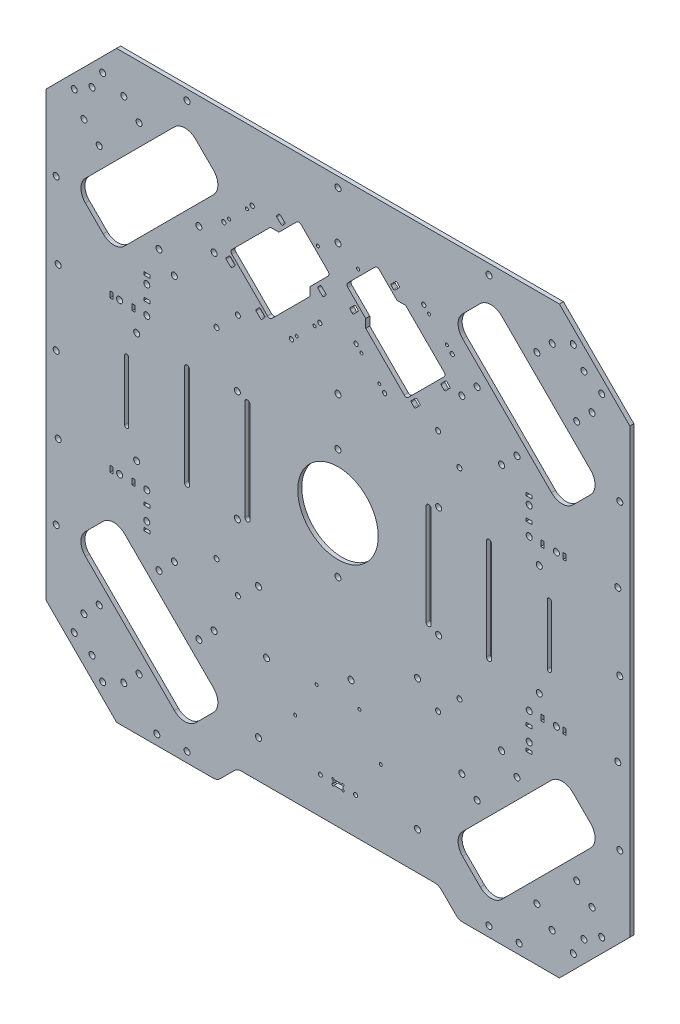
from build123d import *

# Parameters (mm, degrees)
SKETCH_1_W           = 580
SKETCH_1_H           = 580
EXTRUDE_1_DEPTH      = 4
CHAMFER_1_SIZE       = 70
SKETCH_2_R           = 40
CUT_EXTRUDE_1_DEPTH  = 411.141439018
SKETCH_3_R           = 3
CUT_EXTRUDE_3_DEPTH  = 411.141439018
SKETCH_8_R           = 3
CUT_EXTRUDE_6_DEPTH  = 411.141439018
SKETCH_12_R          = 3
SKETCH_12_W          = 3
SKETCH_12_H          = 6
SKETCH_12_W_2        = 6
SKETCH_12_H_2        = 3
CUT_EXTRUDE_7_DEPTH  = 411.141439018
CUT_EXTRUDE_8_DEPTH  = 411.141439018
FILLET_1_R           = 15
SKETCH_14_R          = 2.5
CUT_EXTRUDE_9_DEPTH  = 411.141439018
SKETCH_15_R          = 3
CUT_EXTRUDE_10_DEPTH = 411.141439018
SKETCH_16_R          = 2.1
SKETCH_16_R_2        = 1.5
CUT_EXTRUDE_11_DEPTH = 411.141439018
CUT_EXTRUDE_12_DEPTH = 411.141439018
FILLET_2_R           = 3
CHAMFER_2_SIZE       = 6
SKETCH_18_R          = 1.5
CUT_EXTRUDE_13_DEPTH = 411.141439018
CUT_EXTRUDE_14_DEPTH = 411.141439018
FILLET_4_R           = 1
CUT_EXTRUDE_15_DEPTH = 411.141439018
FILLET_5_R           = 10
SKETCH_21_R          = 1.5
SKETCH_21_R_2        = 2
CUT_EXTRUDE_16_DEPTH = 411.141439018
SKETCH_22_R          = 3
CUT_EXTRUDE_17_DEPTH = 411.141439018
SKETCH_23_W          = 10
SKETCH_23_H          = 5
CUT_EXTRUDE_18_DEPTH = 411.141439018
SKETCH_24_R          = 1
CUT_EXTRUDE_19_DEPTH = 411.141439018
SKETCH_25_R          = 3
CUT_EXTRUDE_20_DEPTH = 411.141439018
SKETCH_26_R          = 3
CUT_EXTRUDE_21_DEPTH = 411.141439018
SKETCH_27_R          = 3
CUT_EXTRUDE_22_DEPTH = 411.141439018
SKETCH_29_R          = 3
CUT_EXTRUDE_24_DEPTH = 411.141439018
CUT_EXTRUDE_23_DEPTH = 411.141439018
SKETCH_31_R          = 3
CUT_EXTRUDE_25_DEPTH = 10
SKETCH_33_R          = 3
CUT_EXTRUDE_26_DEPTH = 10
SKETCH_34_R          = 3
CUT_EXTRUDE_27_DEPTH = 10
SKETCH_35_R          = 3
CUT_EXTRUDE_28_DEPTH = 10


with BuildPart() as part:
    # 草图1 → 凸台-拉伸1 (new body)
    with BuildSketch(Plane.XY):
        Rectangle(SKETCH_1_W, SKETCH_1_H)
    extrude(amount=EXTRUDE_1_DEPTH)

    # 倒角1
    chamfer_1_edges = [part.edges().sort_by_distance(p)[0] for p in [
        (290, -290, 2),
        (-290, -290, 2),
        (-290, 290, 2),
        (290, 290, 2),
    ]]
    chamfer(chamfer_1_edges, length=CHAMFER_1_SIZE)

    # 草图2 → 切除-拉伸1 (cut, through all)
    with BuildSketch(Plane.XY.offset(4)):
        Circle(SKETCH_2_R)
    extrude(amount=-CUT_EXTRUDE_1_DEPTH, mode=Mode.SUBTRACT)

    # 草图3 → 切除-拉伸3 (cut, through all)
    with BuildSketch(Plane.XY.offset(4)):
        with Locations((-162.634559673, -123.036579926)):
            Circle(SKETCH_3_R)
        with Locations((-177.837355468, -138.239375722)):
            Circle(SKETCH_3_R)
        with Locations(Location((-138.239375722, -177.837355468, 0), (0, 0, 180))):
            Circle(SKETCH_3_R)
        with Locations(Location((-123.036579926, -162.634559673, 0), (0, 0, 180))):
            Circle(SKETCH_3_R)
        with Locations((-123.036579926, 162.634559673)):
            Circle(SKETCH_3_R)
        with Locations((-138.239375722, 177.837355468)):
            Circle(SKETCH_3_R)
        with Locations(Location((-162.634559673, 123.036579926, 0), (0, 0, 180))):
            Circle(SKETCH_3_R)
        with Locations(Location((-177.837355468, 138.239375722, 0), (0, 0, 180))):
            Circle(SKETCH_3_R)
        with Locations((162.634559673, 123.036579926)):
            Circle(SKETCH_3_R)
        with Locations((177.837355468, 138.239375722)):
            Circle(SKETCH_3_R)
        with Locations(Location((123.036579926, 162.634559673, 0), (0, 0, 180))):
            Circle(SKETCH_3_R)
        with Locations(Location((138.239375722, 177.837355468, 0), (0, 0, 180))):
            Circle(SKETCH_3_R)
        with Locations((123.036579926, -162.634559673)):
            Circle(SKETCH_3_R)
        with Locations((138.239375722, -177.837355468)):
            Circle(SKETCH_3_R)
        with Locations(Location((162.634559673, -123.036579926, 0), (0, 0, 180))):
            Circle(SKETCH_3_R)
        with Locations(Location((177.837355468, -138.239375722, 0), (0, 0, 180))):
            Circle(SKETCH_3_R)
    extrude(amount=-CUT_EXTRUDE_3_DEPTH, mode=Mode.SUBTRACT)

    # 草图8 → 切除-拉伸6 (cut, through all)
    with BuildSketch(Plane(origin=(0, 0, 0), x_dir=(-1, 0, 0), z_dir=(0, 0, -1))):
        with Locations((-190, 75)):
            Circle(SKETCH_8_R)
        with Locations(Location((-190, -75, 0), (0, 0, 180))):
            Circle(SKETCH_8_R)
        with Locations(Location((190, 75, 0), (0, 0, 180))):
            Circle(SKETCH_8_R)
        with Locations((190, -75)):
            Circle(SKETCH_8_R)
    extrude(amount=-CUT_EXTRUDE_6_DEPTH, mode=Mode.SUBTRACT)

    # 草图12 → 切除-拉伸7 (cut, through all)
    with BuildSketch(Plane.XY.offset(4)):
        with Locations((190, 102)):
            Circle(SKETCH_12_R)
        with Locations(Location((217, 75, 0), (0, 0, 180))):
            Circle(SKETCH_12_R)
        with Locations((217, -75)):
            Circle(SKETCH_12_R)
        with Locations(Location((190, -102, 0), (0, 0, 180))):
            Circle(SKETCH_12_R)
        with Locations((-190, -102)):
            Circle(SKETCH_12_R)
        with Locations(Location((-217, -75, 0), (0, 0, 180))):
            Circle(SKETCH_12_R)
        with Locations((-217, 75)):
            Circle(SKETCH_12_R)
        with Locations(Location((-190, 102, 0), (0, 0, 180))):
            Circle(SKETCH_12_R)
        with Locations((225, 75)):
            Rectangle(SKETCH_12_W, SKETCH_12_H)
        with Locations((190, 88)):
            Rectangle(SKETCH_12_W_2, SKETCH_12_H_2)
        with Locations((203, 75)):
            Rectangle(SKETCH_12_W, SKETCH_12_H)
        with Locations((190, 110)):
            Rectangle(SKETCH_12_W_2, SKETCH_12_H_2)
        with Locations((203, -75)):
            Rectangle(SKETCH_12_W, SKETCH_12_H)
        with Locations((225, -75)):
            Rectangle(SKETCH_12_W, SKETCH_12_H)
        with Locations((190, -110)):
            Rectangle(SKETCH_12_W_2, SKETCH_12_H_2)
        with Locations((190, -88)):
            Rectangle(SKETCH_12_W_2, SKETCH_12_H_2)
        with Locations((-190, -88)):
            Rectangle(SKETCH_12_W_2, SKETCH_12_H_2)
        with Locations((-190, -110)):
            Rectangle(SKETCH_12_W_2, SKETCH_12_H_2)
        with Locations((-225, -75)):
            Rectangle(SKETCH_12_W, SKETCH_12_H)
        with Locations((-203, -75)):
            Rectangle(SKETCH_12_W, SKETCH_12_H)
        with Locations((-190, 110)):
            Rectangle(SKETCH_12_W_2, SKETCH_12_H_2)
        with Locations((-203, 75)):
            Rectangle(SKETCH_12_W, SKETCH_12_H)
        with Locations((-225, 75)):
            Rectangle(SKETCH_12_W, SKETCH_12_H)
        with Locations((-190, 88)):
            Rectangle(SKETCH_12_W_2, SKETCH_12_H_2)
    extrude(amount=-CUT_EXTRUDE_7_DEPTH, mode=Mode.SUBTRACT)

    # 草图13 → 切除-拉伸8 (cut, through all)
    with BuildSketch(Plane.XY.offset(4)):
        Polygon((-222.738636074, -113.13708499), (-261.629509039, -152.027957955), (-152.027957955, -261.629509039), (-113.13708499, -222.738636074), align=None)
        Polygon((-113.13708499, 222.738636074), (-152.027957955, 261.629509039), (-261.629509039, 152.027957955), (-222.738636074, 113.13708499), align=None)
        Polygon((222.738636074, 113.13708499), (261.629509039, 152.027957955), (152.027957955, 261.629509039), (113.13708499, 222.738636074), align=None)
        Polygon((113.13708499, -222.738636074), (152.027957955, -261.629509039), (261.629509039, -152.027957955), (222.738636074, -113.13708499), align=None)
    extrude(amount=-CUT_EXTRUDE_8_DEPTH, mode=Mode.SUBTRACT)

    # 圆角1
    fillet_1_edges = [part.edges().sort_by_distance(p)[0] for p in [
        (113.13708499, -222.738636074, 2),
        (222.738636074, -113.13708499, 2),
        (261.629509039, -152.027957955, 2),
        (152.027957955, -261.629509039, 2),
        (222.738636074, 113.13708499, 2),
        (113.13708499, 222.738636074, 2),
        (152.027957955, 261.629509039, 2),
        (261.629509039, 152.027957955, 2),
        (-113.13708499, 222.738636074, 2),
        (-222.738636074, 113.13708499, 2),
        (-261.629509039, 152.027957955, 2),
        (-152.027957955, 261.629509039, 2),
        (-222.738636074, -113.13708499, 2),
        (-113.13708499, -222.738636074, 2),
        (-152.027957955, -261.629509039, 2),
        (-261.629509039, -152.027957955, 2),
    ]]
    fillet(fillet_1_edges, radius=FILLET_1_R)

    # 草图14 → 切除-拉伸9 (cut, through all)
    with BuildSketch(Plane(origin=(0, 0, 0), x_dir=(-1, 0, 0), z_dir=(0, 0, -1))):
        with Locations((120.703127549, -99.489924113)):
            Circle(SKETCH_14_R)
        with Locations((99.489924113, -120.703127549)):
            Circle(SKETCH_14_R)
        with Locations((-99.489924113, -120.703127549)):
            Circle(SKETCH_14_R)
        with Locations((-120.703127549, -99.489924113)):
            Circle(SKETCH_14_R)
        with Locations((-120.703127549, 99.489924113)):
            Circle(SKETCH_14_R)
        with Locations((-99.489924113, 120.703127549)):
            Circle(SKETCH_14_R)
        with Locations((99.489924113, 120.703127549)):
            Circle(SKETCH_14_R)
        with Locations((120.703127549, 99.489924113)):
            Circle(SKETCH_14_R)
    extrude(amount=-CUT_EXTRUDE_9_DEPTH, mode=Mode.SUBTRACT)

    # 草图15 → 切除-拉伸10 (cut, through all)
    with BuildSketch(Plane.XY.offset(4)):
        with Locations((-252.437120884, -212.839141137)):
            Circle(SKETCH_15_R)
        with Locations((-237.234325088, -197.636345342)):
            Circle(SKETCH_15_R)
        with Locations(Location((-212.839141137, -252.437120884, 0), (0, 0, 180))):
            Circle(SKETCH_15_R)
        with Locations(Location((-197.636345342, -237.234325088, 0), (0, 0, 180))):
            Circle(SKETCH_15_R)
        with Locations((-212.839141137, 252.437120884)):
            Circle(SKETCH_15_R)
        with Locations((-197.636345342, 237.234325088)):
            Circle(SKETCH_15_R)
        with Locations(Location((-252.437120884, 212.839141137, 0), (0, 0, 180))):
            Circle(SKETCH_15_R)
        with Locations(Location((-237.234325088, 197.636345342, 0), (0, 0, 180))):
            Circle(SKETCH_15_R)
        with Locations((252.437120884, 212.839141137)):
            Circle(SKETCH_15_R)
        with Locations((237.234325088, 197.636345342)):
            Circle(SKETCH_15_R)
        with Locations(Location((212.839141137, 252.437120884, 0), (0, 0, 180))):
            Circle(SKETCH_15_R)
        with Locations(Location((197.636345342, 237.234325088, 0), (0, 0, 180))):
            Circle(SKETCH_15_R)
        with Locations((212.839141137, -252.437120884)):
            Circle(SKETCH_15_R)
        with Locations((197.636345342, -237.234325088)):
            Circle(SKETCH_15_R)
        with Locations(Location((252.437120884, -212.839141137, 0), (0, 0, 180))):
            Circle(SKETCH_15_R)
        with Locations(Location((237.234325088, -197.636345342, 0), (0, 0, 180))):
            Circle(SKETCH_15_R)
    extrude(amount=-CUT_EXTRUDE_10_DEPTH, mode=Mode.SUBTRACT)

    # 草图16 → 切除-拉伸11 (cut, through all)
    with BuildSketch(Plane.XY.offset(4)):
        with Locations((85.206367133, 221.96877708)):
            Circle(SKETCH_16_R)
        with Locations((90.509667992, 216.665476221)):
            Circle(SKETCH_16_R_2)
        with Locations((113.49063838, 193.684505832)):
            Circle(SKETCH_16_R)
        with Locations((108.187337522, 198.987806691)):
            Circle(SKETCH_16_R_2)
        with Locations(Location((41.012193309, 131.812662478, 0), (0, 0, 180))):
            Circle(SKETCH_16_R_2)
        with Locations(Location((46.315494168, 126.50936162, 0), (0, 0, 180))):
            Circle(SKETCH_16_R)
        with Locations(Location((18.03122292, 154.793632867, 0), (0, 0, 180))):
            Circle(SKETCH_16_R)
        with Locations(Location((23.334523779, 149.490332008, 0), (0, 0, 180))):
            Circle(SKETCH_16_R_2)
        with Locations((-46.315494168, 126.50936162)):
            Circle(SKETCH_16_R)
        with Locations((-41.012193309, 131.812662478)):
            Circle(SKETCH_16_R_2)
        with Locations((-23.334523779, 149.490332008)):
            Circle(SKETCH_16_R_2)
        with Locations((-18.03122292, 154.793632867)):
            Circle(SKETCH_16_R)
        with Locations(Location((-108.187337522, 198.987806691, 0), (0, 0, 180))):
            Circle(SKETCH_16_R_2)
        with Locations(Location((-113.49063838, 193.684505832, 0), (0, 0, 180))):
            Circle(SKETCH_16_R)
        with Locations(Location((-85.206367133, 221.96877708, 0), (0, 0, 180))):
            Circle(SKETCH_16_R)
        with Locations(Location((-90.509667992, 216.665476221, 0), (0, 0, 180))):
            Circle(SKETCH_16_R_2)
    extrude(amount=-CUT_EXTRUDE_11_DEPTH, mode=Mode.SUBTRACT)

    # 草图17 → 切除-拉伸12 (cut, through all)
    with BuildSketch(Plane.XY.offset(4)):
        Polygon((7.778174593, 201.109127035), (38.890872965, 232.221825407), (62.932503526, 208.180194847), (67.175144213, 212.422835534), (107.48023074, 172.117749006), (67.882250994, 132.51976926), (27.577164466, 172.824855787), (31.819805153, 177.067496474), align=None)
        Polygon((-7.778174593, 201.109127035), (-31.819805153, 177.067496474), (-27.577164466, 172.824855787), (-67.882250994, 132.51976926), (-107.48023074, 172.117749006), (-67.175144213, 212.422835534), (-62.932503526, 208.180194847), (-38.890872965, 232.221825407), align=None)
    extrude(amount=-CUT_EXTRUDE_12_DEPTH, mode=Mode.SUBTRACT)

    # 圆角2
    fillet_2_edges = [part.edges().sort_by_distance(p)[0] for p in [
        (38.890872965, 232.221825407, 2),
        (107.48023074, 172.117749006, 2),
        (67.882250994, 132.51976926, 2),
        (7.778174593, 201.109127035, 2),
        (-38.890872965, 232.221825407, 2),
        (-7.778174593, 201.109127035, 2),
        (-67.882250994, 132.51976926, 2),
        (-107.48023074, 172.117749006, 2),
    ]]
    fillet(fillet_2_edges, radius=FILLET_2_R)

    # 倒角2
    chamfer_2_edges = [part.edges().sort_by_distance(p)[0] for p in [
        (62.932503526, 208.180194847, 2),
        (31.819805153, 177.067496474, 2),
        (-31.819805153, 177.067496474, 2),
        (-62.932503526, 208.180194847, 2),
    ]]
    chamfer(chamfer_2_edges, length=CHAMFER_2_SIZE - 0.0001)  # a hair under: the kernel refuses the full size

    # 草图18 → 切除-拉伸13 (cut, through all)
    with BuildSketch(Plane.XY.offset(4)):
        with Locations((-20, 220)):
            Circle(SKETCH_18_R)
        with Locations(Location((20, 220, 0), (0, 0, 180))):
            Circle(SKETCH_18_R)
    extrude(amount=-CUT_EXTRUDE_13_DEPTH, mode=Mode.SUBTRACT)

    # 草图19 → 切除-拉伸14 (cut, through all)
    with BuildSketch(Plane.XY.offset(4)):
        Polygon((52.325901808, 223.029437252), (55.861435714, 219.493903346), (61.518289963, 225.150757595), (57.982756057, 228.686291501), align=None)
        Polygon((107.48023074, 167.875108319), (101.823376491, 162.218254069), (106.066017178, 157.975613382), (111.722871427, 163.632467632), align=None)
        Polygon((76.367532368, 128.277128573), (72.124891681, 132.51976926), (77.781745931, 138.176623509), (82.024386618, 133.933982822), align=None)
        Polygon((11.313708499, 182.017243943), (16.970562748, 187.674098192), (20.506096654, 184.138564286), (14.849242405, 178.481710037), align=None)
        Polygon((-16.970562748, 187.674098192), (-20.506096654, 184.138564286), (-14.849242405, 178.481710037), (-11.313708499, 182.017243943), align=None)
        Polygon((-72.124891681, 132.51976926), (-77.781745931, 138.176623509), (-82.024386618, 133.933982822), (-76.367532368, 128.277128573), align=None)
        Polygon((-111.722871427, 163.632467632), (-107.48023074, 167.875108319), (-101.823376491, 162.218254069), (-106.066017178, 157.975613382), align=None)
        Polygon((-57.982756057, 228.686291501), (-52.325901808, 223.029437252), (-55.861435714, 219.493903346), (-61.518289963, 225.150757595), align=None)
    extrude(amount=-CUT_EXTRUDE_14_DEPTH, mode=Mode.SUBTRACT)

    # 圆角4
    fillet_4_edges = [part.edges().sort_by_distance(p)[0] for p in [
        (-61.518289963, 225.150757595, 2),
        (-57.982756057, 228.686291501, 2),
        (-52.325901808, 223.029437252, 2),
        (-55.861435714, 219.493903346, 2),
        (-106.066017178, 157.975613382, 2),
        (-111.722871427, 163.632467632, 2),
        (-107.48023074, 167.875108319, 2),
        (-101.823376491, 162.218254069, 2),
        (-72.124891681, 132.51976926, 2),
        (-76.367532368, 128.277128573, 2),
        (-82.024386618, 133.933982822, 2),
        (-77.781745931, 138.176623509, 2),
        (-16.970562748, 187.674098192, 2),
        (-11.313708499, 182.017243943, 2),
        (-14.849242405, 178.481710037, 2),
        (-20.506096654, 184.138564286, 2),
        (14.849242405, 178.481710037, 2),
        (11.313708499, 182.017243943, 2),
        (16.970562748, 187.674098192, 2),
        (20.506096654, 184.138564286, 2),
        (82.024386618, 133.933982822, 2),
        (76.367532368, 128.277128573, 2),
        (72.124891681, 132.51976926, 2),
        (77.781745931, 138.176623509, 2),
        (107.48023074, 167.875108319, 2),
        (111.722871427, 163.632467632, 2),
        (106.066017178, 157.975613382, 2),
        (101.823376491, 162.218254069, 2),
        (52.325901808, 223.029437252, 2),
        (57.982756057, 228.686291501, 2),
        (61.518289963, 225.150757595, 2),
        (55.861435714, 219.493903346, 2),
    ]]
    fillet(fillet_4_edges, radius=FILLET_4_R)

    # 草图20 → 切除-拉伸15 (cut, through all)
    with BuildSketch(Plane.XY.offset(4)):
        Polygon((-120, -290), (-100, -270), (100, -270), (120, -290), align=None)
    extrude(amount=-CUT_EXTRUDE_15_DEPTH, mode=Mode.SUBTRACT)

    # 圆角5
    fillet_5_edges = [part.edges().sort_by_distance(p)[0] for p in [
        (120, -290, 2),
        (-120, -290, 2),
        (-100, -270, 2),
        (100, -270, 2),
    ]]
    fillet(fillet_5_edges, radius=FILLET_5_R)

    # 草图21 → 切除-拉伸16 (cut, through all)
    with BuildSketch(Plane.XY.offset(4)):
        with Locations((-21.25, -158.193920339)):
            Circle(SKETCH_21_R)
        with Locations((21.25, -158.193920339)):
            Circle(SKETCH_21_R)
        with Locations((42.5, -195)):
            Circle(SKETCH_21_R)
        with Locations((-42.5, -195)):
            Circle(SKETCH_21_R)
        with Locations((-17.5, -233.729833462)):
            Circle(SKETCH_21_R_2)
        with Locations((17.5, -233.729833462)):
            Circle(SKETCH_21_R_2)
    extrude(amount=-CUT_EXTRUDE_16_DEPTH, mode=Mode.SUBTRACT)

    # 草图22 → 切除-拉伸17 (cut, through all)
    with BuildSketch(Plane.XY.offset(4)):
        with Locations((12.999999996, -137)):
            Circle(SKETCH_22_R)
        with Locations((-71, -160)):
            Circle(SKETCH_22_R)
    extrude(amount=-CUT_EXTRUDE_17_DEPTH, mode=Mode.SUBTRACT)

    # 草图23 → 切除-拉伸18 (cut, through all)
    with BuildSketch(Plane.XY.offset(4)):
        with Locations((0, -233.729833462)):
            Rectangle(SKETCH_23_W, SKETCH_23_H)
    extrude(amount=-CUT_EXTRUDE_18_DEPTH, mode=Mode.SUBTRACT)

    # 草图24 → 切除-拉伸19 (cut, through all)
    with BuildSketch(Plane.XY.offset(4)):
        with Locations((-5, -231.229833462)):
            Circle(SKETCH_24_R)
        with Locations((5, -231.229833462)):
            Circle(SKETCH_24_R)
        with Locations((-5, -236.229833462)):
            Circle(SKETCH_24_R)
        with Locations((5, -236.229833462)):
            Circle(SKETCH_24_R)
    extrude(amount=-CUT_EXTRUDE_19_DEPTH, mode=Mode.SUBTRACT)

    # 草图25 → 切除-拉伸20 (cut, through all)
    with BuildSketch(Plane.XY.offset(4)):
        with Locations((278, 75)):
            Circle(SKETCH_25_R)
        with Locations(Location((278, -75, 0), (0, 0, 180))):
            Circle(SKETCH_25_R)
        with Locations((-278, -75)):
            Circle(SKETCH_25_R)
        with Locations(Location((-278, 75, 0), (0, 0, 180))):
            Circle(SKETCH_25_R)
    extrude(amount=-CUT_EXTRUDE_20_DEPTH, mode=Mode.SUBTRACT)

    # 草图26 → 切除-拉伸21 (cut, through all)
    with BuildSketch(Plane.XY.offset(4)):
        with Locations((-244.393398282, 244.393398282)):
            Circle(SKETCH_26_R)
        with Locations((244.393398282, 244.393398282)):
            Circle(SKETCH_26_R)
        with Locations((244.393398282, -244.393398282)):
            Circle(SKETCH_26_R)
        with Locations((-244.393398282, -244.393398282)):
            Circle(SKETCH_26_R)
    extrude(amount=-CUT_EXTRUDE_21_DEPTH, mode=Mode.SUBTRACT)

    # 草图27 → 切除-拉伸22 (cut, through all)
    with BuildSketch(Plane.XY.offset(4)):
        with Locations((-150, 280)):
            Circle(SKETCH_27_R)
        with Locations(Location((150, 280, 0), (0, 0, 180))):
            Circle(SKETCH_27_R)
        with Locations((0, 280)):
            Circle(SKETCH_27_R)
        with Locations((280, 150)):
            Circle(SKETCH_27_R)
        with Locations((280, 0)):
            Circle(SKETCH_27_R)
        with Locations(Location((280, -150, 0), (0, 0, 180))):
            Circle(SKETCH_27_R)
        with Locations((150, -280)):
            Circle(SKETCH_27_R)
        with Locations((0, -280)):
            Circle(SKETCH_27_R)
        with Locations(Location((-150, -280, 0), (0, 0, 180))):
            Circle(SKETCH_27_R)
        with Locations((-280, -150)):
            Circle(SKETCH_27_R)
        with Locations((-280, 0)):
            Circle(SKETCH_27_R)
        with Locations(Location((-280, 150, 0), (0, 0, 180))):
            Circle(SKETCH_27_R)
    extrude(amount=-CUT_EXTRUDE_22_DEPTH, mode=Mode.SUBTRACT)

    # 草图29 → 切除-拉伸24 (cut, through all)
    with BuildSketch(Plane.XY.offset(4)):
        with Locations((180, -280)):
            Circle(SKETCH_29_R)
        with Locations(Location((-180, -280, 0), (0, 0, 180))):
            Circle(SKETCH_29_R)
    extrude(amount=-CUT_EXTRUDE_24_DEPTH, mode=Mode.SUBTRACT)

    # 草图28 → 切除-拉伸23 (cut, through all)
    with BuildSketch(Plane.XY.offset(4)):
        with BuildLine():
            Line((87.5, -50), (87.5, 50))
            ThreePointArc((87.5, 50), (90, 52.5), (92.5, 50))
            Line((92.5, 50), (92.5, -50))
            ThreePointArc((92.5, -50), (90, -52.5), (87.5, -50))
        make_face()
        with BuildLine():
            Line((147.5, -50), (147.5, 50))
            ThreePointArc((147.5, 50), (150, 52.5), (152.5, 50))
            Line((152.5, 50), (152.5, -50))
            ThreePointArc((152.5, -50), (150, -52.5), (147.5, -50))
        make_face()
        with BuildLine():
            Line((212, 30), (212, -30))
            ThreePointArc((212, -30), (210, -32), (208, -30))
            Line((208, -30), (208, 30))
            ThreePointArc((208, 30), (210, 32), (212, 30))
        make_face()
        with BuildLine():
            Line((-87.5, -50), (-87.5, 50))
            ThreePointArc((-87.5, 50), (-90, 52.5), (-92.5, 50))
            Line((-92.5, 50), (-92.5, -50))
            ThreePointArc((-92.5, -50), (-90, -52.5), (-87.5, -50))
        make_face()
        with BuildLine():
            Line((-147.5, -50), (-147.5, 50))
            ThreePointArc((-147.5, 50), (-150, 52.5), (-152.5, 50))
            Line((-152.5, 50), (-152.5, -50))
            ThreePointArc((-152.5, -50), (-150, -52.5), (-147.5, -50))
        make_face()
        with BuildLine():
            Line((-212, 30), (-212, -30))
            ThreePointArc((-212, -30), (-210, -32), (-208, -30))
            Line((-208, -30), (-208, 30))
            ThreePointArc((-208, 30), (-210, 32), (-212, 30))
        make_face()
    extrude(amount=-CUT_EXTRUDE_23_DEPTH, mode=Mode.SUBTRACT)

    # 草图31 → 切除-拉伸25 (cut)
    with BuildSketch(Plane.XY.offset(4)):
        with Locations((-233.786796564, 262.071067812)):
            Circle(SKETCH_31_R)
        with Locations((-262.071067812, 233.786796564)):
            Circle(SKETCH_31_R)
        with Locations((233.786796564, 262.071067812)):
            Circle(SKETCH_31_R)
        with Locations((262.071067812, 233.786796564)):
            Circle(SKETCH_31_R)
        with Locations((262.071067812, -233.786796564)):
            Circle(SKETCH_31_R)
        with Locations((233.786796564, -262.071067812)):
            Circle(SKETCH_31_R)
        with Locations((-233.786796564, -262.071067812)):
            Circle(SKETCH_31_R)
        with Locations((-262.071067812, -233.786796564)):
            Circle(SKETCH_31_R)
    extrude(amount=-CUT_EXTRUDE_25_DEPTH, mode=Mode.SUBTRACT)

    # 草图33 → 切除-拉伸26 (cut)
    with BuildSketch(Plane.XY.offset(4)):
        with Locations((0, 55)):
            Circle(SKETCH_33_R)
        with Locations((100, 55)):
            Circle(SKETCH_33_R)
        with Locations((200, 55)):
            Circle(SKETCH_33_R)
        with Locations((-200, 55)):
            Circle(SKETCH_33_R)
        with Locations((-100, 55)):
            Circle(SKETCH_33_R)
        with Locations((200, -55)):
            Circle(SKETCH_33_R)
        with Locations((-100, -55)):
            Circle(SKETCH_33_R)
        with Locations((-200, -55)):
            Circle(SKETCH_33_R)
        with Locations((100, -55)):
            Circle(SKETCH_33_R)
        with Locations((0, -55)):
            Circle(SKETCH_33_R)
    extrude(amount=-CUT_EXTRUDE_26_DEPTH, mode=Mode.SUBTRACT)

    # 草图34 → 切除-拉伸27 (cut)
    with BuildSketch(Plane.XY.offset(4)):
        with Locations((0, 232.5)):
            Circle(SKETCH_34_R)
        with Locations((0, 102.5)):
            Circle(SKETCH_34_R)
    extrude(amount=-CUT_EXTRUDE_27_DEPTH, mode=Mode.SUBTRACT)

    # 草图35 → 切除-拉伸28 (cut)
    with BuildSketch(Plane.XY.offset(4)):
        with Locations((-79, -232.5)):
            Circle(SKETCH_35_R)
        with Locations((-79, -102.5)):
            Circle(SKETCH_35_R)
        with Locations((79, -102.5)):
            Circle(SKETCH_35_R)
        with Locations((79, -232.5)):
            Circle(SKETCH_35_R)
    extrude(amount=-CUT_EXTRUDE_28_DEPTH, mode=Mode.SUBTRACT)


solid = part.part
